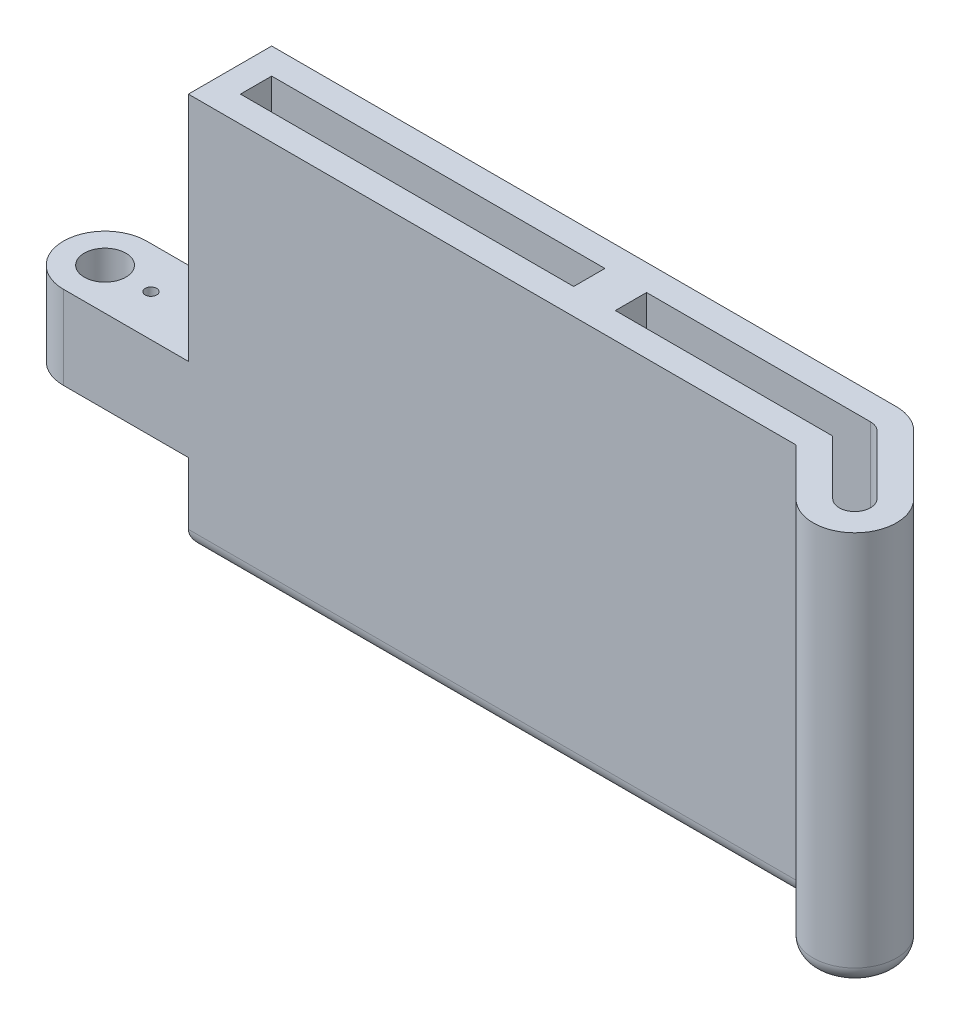
from build123d import *

# Parameters (mm, degrees)
BOSS_EXTRUDE1_DEPTH = 59.999999888
SKETCH2_W           = 25.4
SKETCH2_H           = 12.017000096
SKETCH2_H_2         = 35.282999792
CUT_EXTRUDE1_DEPTH  = 144.406043417
SKETCH3_R           = 0.877000024
CUT_EXTRUDE2_DEPTH  = 140.073319957
SKETCH4_R           = 3.175
CUT_EXTRUDE3_DEPTH  = 140.073319957
SKETCH5_W           = 50.8
SKETCH5_H           = 4.7625
CUT_EXTRUDE4_DEPTH  = 144.66286939
FILLET1_R           = 2.54


with BuildPart() as part:
    # Sketch1 → Boss-Extrude1 (new body)
    with BuildSketch(Plane(origin=(0, 0, 0), x_dir=(1, 0, 0), z_dir=(0, 1, 0))):
        with BuildLine():
            Line((114.3, 6.35), (0, 6.35))
            ThreePointArc((0, 6.35), (-6.35, 0), (0, -6.35))
            Line((0, -6.35), (111.669743879, -6.35))
            Line((111.669743879, -6.35), (118.790128061, -13.470384182))
            ThreePointArc((118.790128061, -13.470384182), (127.770384182, -13.470384182), (127.770384182, -4.490128061))
            Line((127.770384182, -4.490128061), (118.790128061, 4.490128061))
            ThreePointArc((118.790128061, 4.490128061), (116.730039796, 5.866635031), (114.3, 6.35))
        make_face()
    extrude(amount=BOSS_EXTRUDE1_DEPTH)

    # Sketch2 → Cut-Extrude1 (cut, through all)
    with BuildSketch(Plane.XY.offset(6.35)):
        with Locations((6.35, 6.008500048)):
            Rectangle(SKETCH2_W, SKETCH2_H)
        with Locations((6.35, 42.358499992)):
            Rectangle(SKETCH2_W, SKETCH2_H_2)
    extrude(amount=-CUT_EXTRUDE1_DEPTH, mode=Mode.SUBTRACT)

    # Sketch3 → Cut-Extrude2 (cut, through all)
    with BuildSketch(Plane.XZ.offset(-12.017000096)):
        with Locations((6.99999997, 0)):
            Circle(SKETCH3_R)
        with Locations((16.000000004, 0)):
            Circle(SKETCH3_R)
    extrude(amount=-CUT_EXTRUDE2_DEPTH, mode=Mode.SUBTRACT)

    # Sketch4 → Cut-Extrude3 (cut, through all)
    with BuildSketch(Plane.XZ.offset(-12.017000096)):
        Circle(SKETCH4_R)
    extrude(amount=-CUT_EXTRUDE3_DEPTH, mode=Mode.SUBTRACT)

    # Sketch5 → Cut-Extrude4 (cut, through all)
    with BuildSketch(Plane(origin=(0, 59.999999888, 0), x_dir=(1, 0, 0), z_dir=(0, 1, 0))):
        with Locations((48.41875, 0)):
            Rectangle(SKETCH5_W, SKETCH5_H)
        with BuildLine():
            Line((80.16875, 2.38125), (80.16875, -2.38125))
            Line((80.16875, -2.38125), (113.313653955, -2.38125))
            Line((113.313653955, -2.38125), (121.596458098, -10.664054144))
            ThreePointArc((121.596458098, -10.664054144), (124.964054144, -10.664054144), (124.964054144, -7.296458098))
            Line((124.964054144, -7.296458098), (115.983798023, 1.683798023))
            ThreePointArc((115.983798023, 1.683798023), (115.211264923, 2.199988137), (114.3, 2.38125))
            Line((114.3, 2.38125), (80.16875, 2.38125))
        make_face()
    extrude(amount=-CUT_EXTRUDE4_DEPTH, mode=Mode.SUBTRACT)

    # Fillet1
    fillet1_edges = [part.edges().sort_by_distance(p)[0] for p in [
        (127.770384182, 0, 13.470384182),
        (115.22993597, 0, 9.910192091),
        (116.730039796, 0, -5.866635031),
        (123.280256121, 0, 0),
        (66.675, 0, -6.35),
        (19.05, 0, 0),
        (65.359871939, 0, 6.35),
    ]]
    fillet(fillet1_edges, radius=FILLET1_R)


solid = part.part
